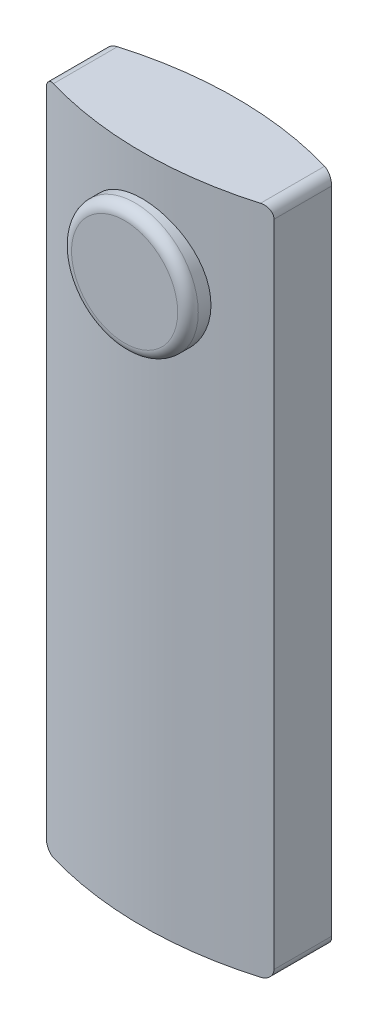
from build123d import *

# Parameters (mm, degrees)
BOSS_EXTRUDE1_DEPTH = 130.12
SKETCH6_R           = 12.3
BOSS_EXTRUDE2_DEPTH = 12.5
SKETCH7_R           = 2.35
BOSS_EXTRUDE3_DEPTH = 2
FILLET1_R           = 2
FILLET2_R           = 2
FILLET3_R           = 2


with BuildPart() as part:
    # Sketch5 → Boss-Extrude1 (new body)
    with BuildSketch(Plane(origin=(0, 0, 0), x_dir=(1, 0, 0), z_dir=(0, 1, 0))):
        with BuildLine():
            Line((-22.1, 5.6), (-22.1, -5.6))
            ThreePointArc((-22.1, -5.6), (0, -9.1), (22.1, -5.6))
            Line((22.1, -5.6), (22.1, 5.6))
            ThreePointArc((22.1, 5.6), (0, 9.1), (-22.1, 5.6))
        make_face()
    extrude(amount=BOSS_EXTRUDE1_DEPTH)

    # Sketch6 → Boss-Extrude2 (add, symmetric)
    with BuildSketch(Plane.XY):
        with Locations((0, 110)):
            Circle(SKETCH6_R)
    extrude(amount=BOSS_EXTRUDE2_DEPTH, both=True)

    # Sketch7 → Boss-Extrude3 (add)
    with BuildSketch(Plane.ZY.offset(22.1)):
        with Locations((0, 94.5)):
            Circle(SKETCH7_R)
        with Locations((0, 79.5)):
            Circle(SKETCH7_R)
        with Locations((0, 64.5)):
            Circle(SKETCH7_R)
    extrude(amount=BOSS_EXTRUDE3_DEPTH)

    # Fillet1
    fillet1_edges = [part.edges().sort_by_distance(p)[0] for p in [
        (-12.3, 110, 12.5),
    ]]
    fillet(fillet1_edges, radius=FILLET1_R)

    # Fillet2
    fillet2_edges = [part.edges().sort_by_distance(p)[0] for p in [
        (22.1, 130.12, 0),
        (-22.1, 130.12, 0),
    ]]
    fillet(fillet2_edges, radius=FILLET2_R)

    # Fillet3
    fillet3_edges = [part.edges().sort_by_distance(p)[0] for p in [
        (22.1, 0, 0),
        (-22.1, 0, 0),
    ]]
    fillet(fillet3_edges, radius=FILLET3_R)


solid = part.part
